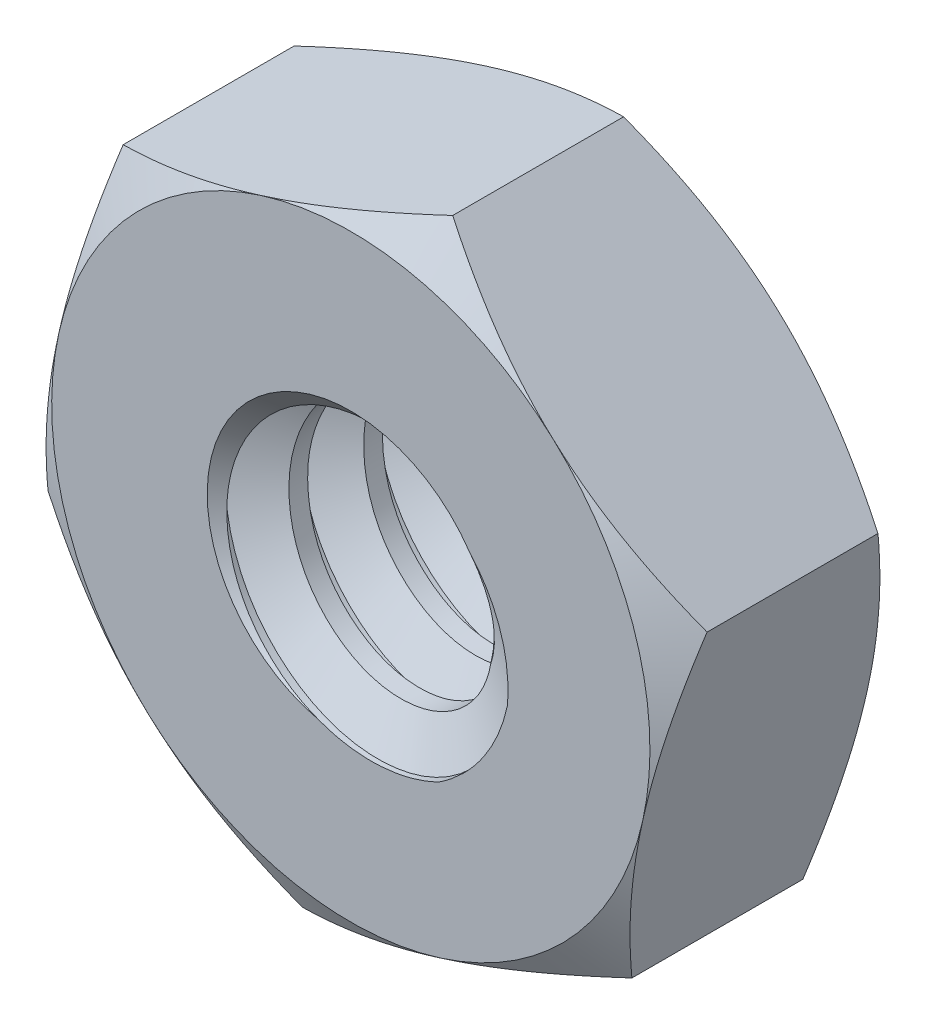
from build123d import *

# Parameters (mm, degrees)
BOSS_EXTRUDE1_DEPTH = 2.38125
SKETCH7_R           = 1.27
CUT_EXTRUDE1_DEPTH  = 6.541605661
SKETCH13_OUTSIDE_W  = 19.302
SKETCH13_OUTSIDE_H  = 19.462
SKETCH13_OUTSIDE_R  = 3.175002494
CUT_EXTRUDE2_DEPTH  = 2.38125
CUT_EXTRUDE2_DRAFT  = -60
SKETCH14_OUTSIDE_W  = 19.302
SKETCH14_OUTSIDE_H  = 19.462
SKETCH14_OUTSIDE_R  = 3.175
CUT_EXTRUDE3_DEPTH  = 2.38125
CUT_EXTRUDE3_DRAFT  = -60
CHAMFER1_SIZE       = 0.254
THREAD2_PITCH       = 0.79375


with BuildPart() as part:
    # Sketch1 → Boss-Extrude1 (new body)
    with BuildSketch(Plane.XY):
        Polygon((2.700015536, -2.48007045), (3.497811781, 1.09824682), (0.797796245, 3.57831727), (-2.700015536, 2.48007045), (-3.497811781, -1.09824682), (-0.797796245, -3.57831727), align=None)
    extrude(amount=BOSS_EXTRUDE1_DEPTH)

    # Sketch7 → Cut-Extrude1 (cut, through all)
    with BuildSketch(Plane(origin=(0, 0, 0), x_dir=(-1, 0, 0), z_dir=(0, 0, -1))):
        Circle(SKETCH7_R)
    extrude(amount=-CUT_EXTRUDE1_DEPTH, mode=Mode.SUBTRACT)


with BuildPart() as cut_extrude2_tool:
    # Sketch13 outside → Cut-Extrude2 (with draft: the straight prism first)
    with BuildSketch(Plane(origin=(0, 0, 0), x_dir=(-1, 0, 0), z_dir=(0, 0, -1))):
        Rectangle(SKETCH13_OUTSIDE_W, SKETCH13_OUTSIDE_H)
        Circle(SKETCH13_OUTSIDE_R, mode=Mode.SUBTRACT)
    extrude(amount=-CUT_EXTRUDE2_DEPTH)
    # Cut-Extrude2: the draft: its side faces are tilted about the plane it starts from
    cut_extrude2_sides = [cut_extrude2_tool.faces().sort_by_distance(p)[0] for p in [
        (0, -9.731, 1.190625),
        (-9.651, 0, 1.190625),
        (0, 9.731, 1.190625),
        (9.651, 0, 1.190625),
        (3.175002494, 0, 1.190625),
    ]]
    draft(cut_extrude2_sides, Plane(origin=(0, 0, 0), x_dir=(-1, 0, 0), z_dir=(0, 0, -1)), CUT_EXTRUDE2_DRAFT)


with BuildPart() as part_1:
    add(part.part)

    # Cut-Extrude2: cut by cut_extrude2_tool
    add(cut_extrude2_tool.part, mode=Mode.SUBTRACT)


with BuildPart() as cut_extrude3_tool:
    # Sketch14 outside → Cut-Extrude3 (with draft: the straight prism first)
    with BuildSketch(Plane.XY.offset(2.38125)):
        Rectangle(SKETCH14_OUTSIDE_W, SKETCH14_OUTSIDE_H)
        Circle(SKETCH14_OUTSIDE_R, mode=Mode.SUBTRACT)
    extrude(amount=-CUT_EXTRUDE3_DEPTH)
    # Cut-Extrude3: the draft: its side faces are tilted about the plane it starts from
    cut_extrude3_sides = [cut_extrude3_tool.faces().sort_by_distance(p)[0] for p in [
        (0, -9.731, 1.190625),
        (9.651, 0, 1.190625),
        (0, 9.731, 1.190625),
        (-9.651, 0, 1.190625),
        (-3.175, 0, 1.190625),
    ]]
    draft(cut_extrude3_sides, Plane.XY.offset(2.38125), CUT_EXTRUDE3_DRAFT)


with BuildPart() as part_2:
    add(part_1.part)

    # Cut-Extrude3: cut by cut_extrude3_tool
    add(cut_extrude3_tool.part, mode=Mode.SUBTRACT)

    # Chamfer1
    chamfer1_edges = [part_2.edges().sort_by_distance(p)[0] for p in [
        (1.27, 0, 2.38125),
        (1.27, 0, 0),
    ]]
    chamfer(chamfer1_edges, length=CHAMFER1_SIZE)

    # Thread2: the profile of Thread Profile3 profile screwed along a right-hand helix of 4.28 turns, 8 arcs to a turn; built about Z, then put on its axis
    thread2_z = Axis((0, 0, 0), (0, 0, 1))
    thread2_corners = [(1.2697, 0, -0.000173205), (1.699629788, 0, 0.248046874), (1.699629788, 0, 0.347265624), (1.2697, 0, 0.595485703)]
    with BuildLine(mode=Mode.PRIVATE) as thread2_profile:
        Line(thread2_corners[0], thread2_corners[1])
        Line(thread2_corners[1], thread2_corners[2])
        Line(thread2_corners[2], thread2_corners[3])
        Line(thread2_corners[3], thread2_corners[0])
    thread2_cap = Face(thread2_profile.wire())
    thread2_turn_angles = [0, 22.5, 45, 67.5, 90, 112.5, 135, 157.5, 180, 202.5, 225, 247.5, 270, 292.5, 315, 337.5, 360]
    thread2_turn_weights = [1, 0.9238795325112867, 1, 0.9238795325112867, 1, 0.9238795325112867, 1, 0.9238795325112867, 1, 0.9238795325112867, 1, 0.9238795325112867, 1, 0.9238795325112867, 1, 0.9238795325112867, 1]
    thread2_turn_rails = [Edge.make_bspline([Vector(p[0], p[1], 0).rotate(thread2_z, thread2_turn_angles[k]) / thread2_turn_weights[k] + Vector(0, 0, p[2] + THREAD2_PITCH * thread2_turn_angles[k] / 360) for k in range(17)], [0, 0, 0, 1, 1, 2, 2, 3, 3, 4, 4, 5, 5, 6, 6, 7, 7, 8, 8, 8], 2, thread2_turn_weights) for p in thread2_corners]
    thread2_turn_sides = [Face.make_surface_from_curves(thread2_turn_rails[p[0]], thread2_turn_rails[p[1]]) for p in [(0, 1), (1, 2), (2, 3), (3, 0)]]
    thread2_last_angles = [1440, 1462.5, 1485, 1507.5, 1530, 1535.4, 1540.8]
    thread2_last_weights = [1, 0.9238795325112867, 1, 0.9238795325112867, 1, 0.9955619646030823, 1]
    thread2_last_rails = [Edge.make_bspline([Vector(p[0], p[1], 0).rotate(thread2_z, thread2_last_angles[k]) / thread2_last_weights[k] + Vector(0, 0, p[2] + THREAD2_PITCH * thread2_last_angles[k] / 360) for k in range(7)], [0, 0, 0, 1, 1, 2, 2, 3, 3, 3], 2, thread2_last_weights) for p in thread2_corners]
    thread2_last_sides = [Face.make_surface_from_curves(thread2_last_rails[p[0]], thread2_last_rails[p[1]]) for p in [(0, 1), (1, 2), (2, 3), (3, 0)]]
    thread2 = Plane(origin=(0, 0, -1.016), x_dir=(1, 0, 0), z_dir=(0, 0, 1)) * Solid(Shell([*[p.moved(Location((0, 0, THREAD2_PITCH * i))) for i in range(4) for p in thread2_turn_sides], *thread2_last_sides, thread2_cap, thread2_cap.rotate(thread2_z, 1540.8).moved(Location((0, 0, THREAD2_PITCH * 1540.8 / 360)))]))
    add(thread2, mode=Mode.SUBTRACT)


solid = part_2.part
